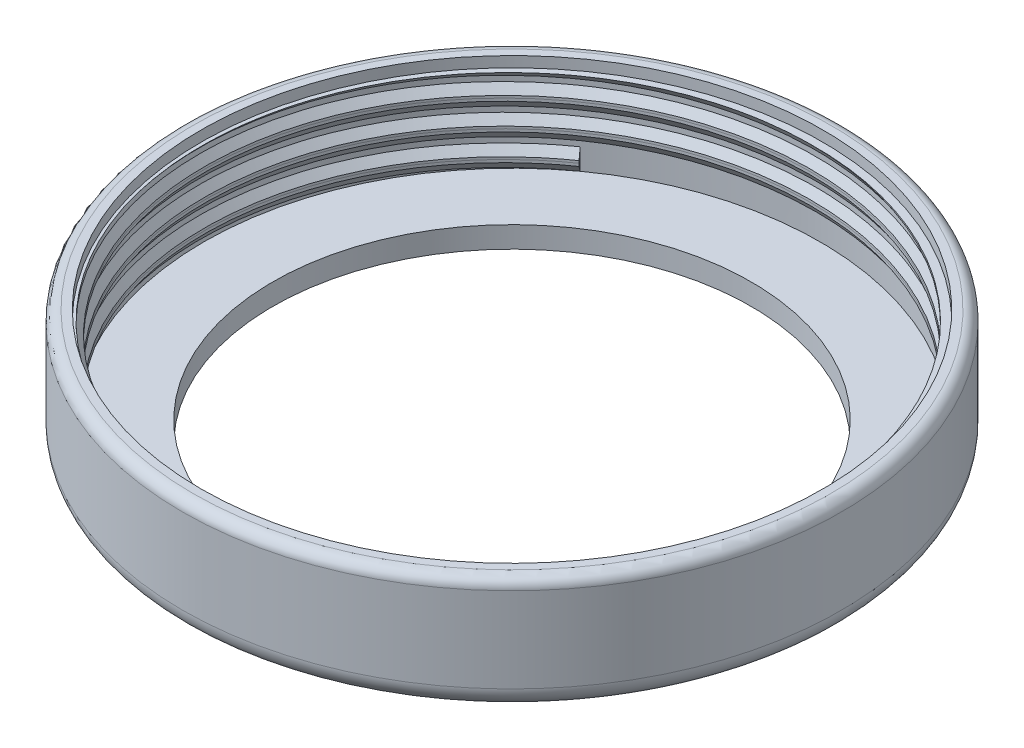
from build123d import *

# Parameters (mm, degrees)
SKETCH1_R           = 31
BOSS_EXTRUDE1_DEPTH = 11
SHELL1_T            = -2
SKETCH2_R           = 22.5
CUT_EXTRUDE1_DEPTH  = 2
FILLET1_R           = 2
FILLET2_R           = 1
SWEEP2_PITCH        = 2.5
SKETCH8_R           = 29.25
CUT_EXTRUDE6_DEPTH  = 6


with BuildPart() as part:
    # Sketch1 → Boss-Extrude1 (new body)
    with BuildSketch(Plane(origin=(0, 0, 0), x_dir=(1, 0, 0), z_dir=(0, 1, 0))):
        with Locations(Location((0, 0, 0), (0, 0, 270))):
            Circle(SKETCH1_R)
    extrude(amount=BOSS_EXTRUDE1_DEPTH)

    # Shell1
    shell1_openings = [part.faces().sort_by_distance(p)[0] for p in [
        (0, 11, 0),
    ]]
    offset(amount=SHELL1_T, openings=shell1_openings, kind=Kind.INTERSECTION)

    # Sketch2 → Cut-Extrude1 (cut)
    with BuildSketch(Plane(origin=(0, 0, 0), x_dir=(1, 0, 0), z_dir=(0, 1, 0))):
        with Locations(Location((0, 0, 0), (0, 0, 270))):
            Circle(SKETCH2_R)
    extrude(amount=CUT_EXTRUDE1_DEPTH, mode=Mode.SUBTRACT)

    # Fillet1
    fillet1_edges = [part.edges().sort_by_distance(p)[0] for p in [
        (0, 0, -31),
    ]]
    fillet(fillet1_edges, radius=FILLET1_R)

    # Fillet2
    fillet2_edges = [part.edges().sort_by_distance(p)[0] for p in [
        (0, 11, -31),
    ]]
    fillet(fillet2_edges, radius=FILLET2_R)

    # Sweep2: the profile of Sketch9 screwed along a right-hand helix of 4.4 turns, 10 arcs to a turn; built about Z, then put on its axis
    sweep2_z = Axis((0, 0, 0), (0, 0, 1))
    sweep2_corners = [(29.003757018, 0, 0), (29.003757018, 0, -1), (28.503757018, 0, -0.216536346), (28.503757018, 0, 0), (28.503757018, 0, 0.260114356), (29.003757018, 0, 1.005601618)]
    with BuildLine(mode=Mode.PRIVATE) as sweep2_profile:
        Line(sweep2_corners[0], sweep2_corners[1])
        Line(sweep2_corners[1], sweep2_corners[2])
        Line(sweep2_corners[2], sweep2_corners[3])
        Line(sweep2_corners[3], sweep2_corners[4])
        Line(sweep2_corners[4], sweep2_corners[5])
        Line(sweep2_corners[5], sweep2_corners[0])
    sweep2_cap = Face(sweep2_profile.wire())
    sweep2_turn_angles = [0, 18, 36, 54, 72, 90, 108, 126, 144, 162, 180, 198, 216, 234, 252, 270, 288, 306, 324, 342, 360]
    sweep2_turn_weights = [1, 0.9510565162951535, 1, 0.9510565162951535, 1, 0.9510565162951535, 1, 0.9510565162951535, 1, 0.9510565162951535, 1, 0.9510565162951535, 1, 0.9510565162951535, 1, 0.9510565162951535, 1, 0.9510565162951535, 1, 0.9510565162951535, 1]
    sweep2_turn_rails = [Edge.make_bspline([Vector(p[0], p[1], 0).rotate(sweep2_z, sweep2_turn_angles[k]) / sweep2_turn_weights[k] + Vector(0, 0, p[2] + SWEEP2_PITCH * sweep2_turn_angles[k] / 360) for k in range(21)], [0, 0, 0, 1, 1, 2, 2, 3, 3, 4, 4, 5, 5, 6, 6, 7, 7, 8, 8, 9, 9, 10, 10, 10], 2, sweep2_turn_weights) for p in sweep2_corners]
    sweep2_turn_sides = [Face.make_surface_from_curves(sweep2_turn_rails[p[0]], sweep2_turn_rails[p[1]]) for p in [(0, 1), (1, 2), (2, 3), (3, 4), (4, 5), (5, 0)]]
    sweep2_last_angles = [1440, 1458, 1476, 1494, 1512, 1530, 1548, 1566, 1584]
    sweep2_last_weights = [1, 0.9510565162951535, 1, 0.9510565162951535, 1, 0.9510565162951535, 1, 0.9510565162951394, 1]
    sweep2_last_rails = [Edge.make_bspline([Vector(p[0], p[1], 0).rotate(sweep2_z, sweep2_last_angles[k]) / sweep2_last_weights[k] + Vector(0, 0, p[2] + SWEEP2_PITCH * sweep2_last_angles[k] / 360) for k in range(9)], [0, 0, 0, 1, 1, 2, 2, 3, 3, 4, 4, 4], 2, sweep2_last_weights) for p in sweep2_corners]
    sweep2_last_sides = [Face.make_surface_from_curves(sweep2_last_rails[p[0]], sweep2_last_rails[p[1]]) for p in [(0, 1), (1, 2), (2, 3), (3, 4), (4, 5), (5, 0)]]
    sweep2 = Plane(origin=(0, 14, 0), x_dir=(0, 0, 1), z_dir=(0, -1, 0)) * Solid(Shell([*[p.moved(Location((0, 0, SWEEP2_PITCH * i))) for i in range(4) for p in sweep2_turn_sides], *sweep2_last_sides, sweep2_cap, sweep2_cap.rotate(sweep2_z, 1584).moved(Location((0, 0, SWEEP2_PITCH * 1584 / 360)))]))
    add(sweep2)

    # Sketch8 → Cut-Extrude6 (cut)
    with BuildSketch(Plane(origin=(0, 16, 0), x_dir=(1, 0, 0), z_dir=(0, 1, 0))):
        with Locations(Location((0, 0, 0), (0, 0, 270))):
            Circle(SKETCH8_R)
    extrude(amount=-CUT_EXTRUDE6_DEPTH, mode=Mode.SUBTRACT)


solid = part.part
